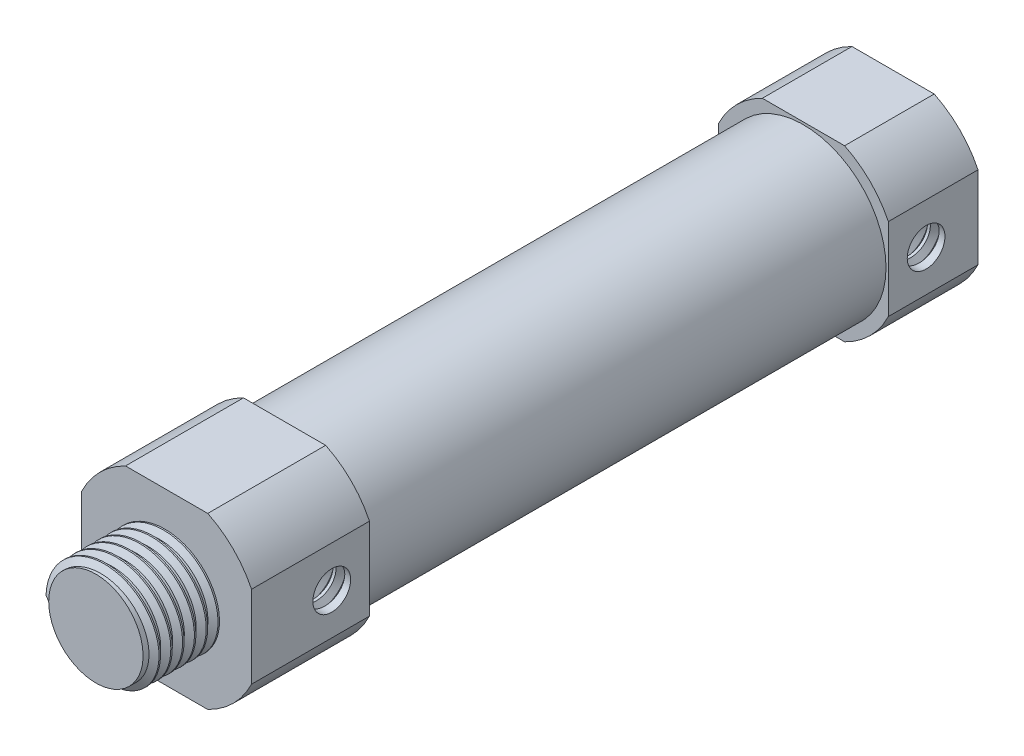
from build123d import *
from build123d.topology import SkipClean

# Parameters (mm, degrees)
SKETCH_1_R          = 10
EXTRUDE_1_DEPTH     = 9.5
SKETCH_2_R          = 15
SKETCH_2_W          = 18
SKETCH_2_H          = 18
CUT_EXTRUDE_1_DEPTH = 9.5
SKETCH_3_R          = 8.75
EXTRUDE_2_DEPTH     = 55
EXTRUDE_3_DEPTH     = 12.5
SKETCH_5_R          = 5
EXTRUDE_4_DEPTH     = 7.5
THREAD_1_PITCH      = 1.25
SKETCH_11_R         = 2
CUT_EXTRUDE_2_DEPTH = 5
THREAD_2_PITCH      = 1.25
THREAD_3_PITCH      = 1.25


with BuildPart() as part:
    # Sketch 1 → 凸台-拉伸1 (new body)
    with BuildSketch(Plane.XY):
        Circle(SKETCH_1_R)
    extrude(amount=EXTRUDE_1_DEPTH)

    # Sketch 2 → 切除-拉伸1 (cut)
    with BuildSketch(Plane.XY.offset(9.5)):
        Circle(SKETCH_2_R)
        Rectangle(SKETCH_2_W, SKETCH_2_H, mode=Mode.SUBTRACT)
    extrude(amount=-CUT_EXTRUDE_1_DEPTH, mode=Mode.SUBTRACT)

    # Sketch 3 → 凸台-拉伸2 (add)
    with BuildSketch(Plane.XY.offset(9.5)):
        Circle(SKETCH_3_R)
    extrude(amount=EXTRUDE_2_DEPTH)

    # 草图4 → 凸台-拉伸3 (add)
    with BuildSketch(Plane.XY.offset(64.5)):
        with BuildLine():
            Line((-4.358898944, -9), (4.358898944, -9))
            ThreePointArc((4.358898944, -9), (7.071067812, -7.071067812), (9, -4.358898944))
            Line((9, -4.358898944), (9, 4.358898944))
            ThreePointArc((9, 4.358898944), (7.071067812, 7.071067812), (4.358898944, 9))
            Line((4.358898944, 9), (-4.358898944, 9))
            ThreePointArc((-4.358898944, 9), (-7.071067812, 7.071067812), (-9, 4.358898944))
            Line((-9, 4.358898944), (-9, -4.358898944))
            ThreePointArc((-9, -4.358898944), (-7.071067812, -7.071067812), (-4.358898944, -9))
        make_face()
    extrude(amount=EXTRUDE_3_DEPTH)

    # 草图5 → 凸台-拉伸4 (add)
    with BuildSketch(Plane.XY.offset(77)):
        Circle(SKETCH_5_R)
    extrude(amount=EXTRUDE_4_DEPTH)

    # 螺纹线1: the profile of Sketch 1 2 profile screwed along a right-hand helix of 6 turns, 8 arcs to a turn; built about Z, then put on its axis
    thread_1_z = Axis((0, 0, 0), (0, 0, 1))
    thread_1_corners = [(4.9997, 0, -0.000173205), (5.676582344, 0, 0.390624998), (5.676582344, 0, 0.546874998), (4.9997, 0, 0.937673202)]
    with BuildLine(mode=Mode.PRIVATE) as thread_1_profile:
        Line(thread_1_corners[0], thread_1_corners[1])
        Line(thread_1_corners[1], thread_1_corners[2])
        Line(thread_1_corners[2], thread_1_corners[3])
        Line(thread_1_corners[3], thread_1_corners[0])
    thread_1_cap = Face(thread_1_profile.wire())
    thread_1_turn_angles = [0, 22.5, 45, 67.5, 90, 112.5, 135, 157.5, 180, 202.5, 225, 247.5, 270, 292.5, 315, 337.5, 360]
    thread_1_turn_weights = [1, 0.9238795325112867, 1, 0.9238795325112867, 1, 0.9238795325112867, 1, 0.9238795325112867, 1, 0.9238795325112867, 1, 0.9238795325112867, 1, 0.9238795325112867, 1, 0.9238795325112867, 1]
    thread_1_turn_rails = [Edge.make_bspline([Vector(p[0], p[1], 0).rotate(thread_1_z, thread_1_turn_angles[k]) / thread_1_turn_weights[k] + Vector(0, 0, p[2] + THREAD_1_PITCH * thread_1_turn_angles[k] / 360) for k in range(17)], [0, 0, 0, 1, 1, 2, 2, 3, 3, 4, 4, 5, 5, 6, 6, 7, 7, 8, 8, 8], 2, thread_1_turn_weights) for p in thread_1_corners]
    thread_1_turn_sides = [Face.make_surface_from_curves(thread_1_turn_rails[p[0]], thread_1_turn_rails[p[1]]) for p in [(0, 1), (1, 2), (2, 3), (3, 0)]]
    thread_1 = Plane(origin=(0, 0, 84.5), x_dir=(-1, 0, 0), z_dir=(0, 0, -1)) * Solid(Shell([*[p.moved(Location((0, 0, THREAD_1_PITCH * i))) for i in range(6) for p in thread_1_turn_sides], thread_1_cap, thread_1_cap.rotate(thread_1_z, 2160).moved(Location((0, 0, THREAD_1_PITCH * 2160 / 360)))]))
    add(thread_1)

    # 草图11 → 切除-拉伸2 (cut)
    with BuildSketch(Plane(origin=(9, 0, 0), x_dir=(0, 0, -1), z_dir=(1, 0, 0))):
        with Locations((-68.5, 0)):
            Circle(SKETCH_11_R)
        with Locations((-5.5, 0)):
            Circle(SKETCH_11_R)
    extrude(amount=-CUT_EXTRUDE_2_DEPTH, mode=Mode.SUBTRACT)

    # 螺纹线2: the profile of Sketch 2 2 profile screwed along a right-hand helix of 4 turns, 8 arcs to a turn; built about Z, then put on its axis
    with SkipClean():  # the faces are left unmerged after this step: merging them gives an invalid solid
        thread_2_z = Axis((0, 0, 0), (0, 0, 1))
        thread_2_corners = [(1.9997, 0, -0.000173205), (2.676582344, 0, 0.390624998), (2.676582344, 0, 0.546874998), (1.9997, 0, 0.937673202)]
        with BuildLine(mode=Mode.PRIVATE) as thread_2_profile:
            Line(thread_2_corners[0], thread_2_corners[1])
            Line(thread_2_corners[1], thread_2_corners[2])
            Line(thread_2_corners[2], thread_2_corners[3])
            Line(thread_2_corners[3], thread_2_corners[0])
        thread_2_cap = Face(thread_2_profile.wire())
        thread_2_turn_angles = [0, 22.5, 45, 67.5, 90, 112.5, 135, 157.5, 180, 202.5, 225, 247.5, 270, 292.5, 315, 337.5, 360]
        thread_2_turn_weights = [1, 0.9238795325112867, 1, 0.9238795325112867, 1, 0.9238795325112867, 1, 0.9238795325112867, 1, 0.9238795325112867, 1, 0.9238795325112867, 1, 0.9238795325112867, 1, 0.9238795325112867, 1]
        thread_2_turn_rails = [Edge.make_bspline([Vector(p[0], p[1], 0).rotate(thread_2_z, thread_2_turn_angles[k]) / thread_2_turn_weights[k] + Vector(0, 0, p[2] + THREAD_2_PITCH * thread_2_turn_angles[k] / 360) for k in range(17)], [0, 0, 0, 1, 1, 2, 2, 3, 3, 4, 4, 5, 5, 6, 6, 7, 7, 8, 8, 8], 2, thread_2_turn_weights) for p in thread_2_corners]
        thread_2_turn_sides = [Face.make_surface_from_curves(thread_2_turn_rails[p[0]], thread_2_turn_rails[p[1]]) for p in [(0, 1), (1, 2), (2, 3), (3, 0)]]
        thread_2 = Plane(origin=(9, 0, 68.5), x_dir=(0, 0, 1), z_dir=(-1, 0, 0)) * Solid(Shell([*[p.moved(Location((0, 0, THREAD_2_PITCH * i))) for i in range(4) for p in thread_2_turn_sides], thread_2_cap, thread_2_cap.rotate(thread_2_z, 1440).moved(Location((0, 0, THREAD_2_PITCH * 1440 / 360)))]))
        add(thread_2, mode=Mode.SUBTRACT)

    # 螺纹线3: the profile of Sketch 3 2 profile screwed along a right-hand helix of 4 turns, 8 arcs to a turn; built about Z, then put on its axis
    with SkipClean():  # the faces are left unmerged after this step: merging them gives an invalid solid
        thread_3_z = Axis((0, 0, 0), (0, 0, 1))
        thread_3_corners = [(1.9997, 0, -0.000173205), (2.676582344, 0, 0.390624998), (2.676582344, 0, 0.546874998), (1.9997, 0, 0.937673202)]
        with BuildLine(mode=Mode.PRIVATE) as thread_3_profile:
            Line(thread_3_corners[0], thread_3_corners[1])
            Line(thread_3_corners[1], thread_3_corners[2])
            Line(thread_3_corners[2], thread_3_corners[3])
            Line(thread_3_corners[3], thread_3_corners[0])
        thread_3_cap = Face(thread_3_profile.wire())
        thread_3_turn_angles = [0, 22.5, 45, 67.5, 90, 112.5, 135, 157.5, 180, 202.5, 225, 247.5, 270, 292.5, 315, 337.5, 360]
        thread_3_turn_weights = [1, 0.9238795325112867, 1, 0.9238795325112867, 1, 0.9238795325112867, 1, 0.9238795325112867, 1, 0.9238795325112867, 1, 0.9238795325112867, 1, 0.9238795325112867, 1, 0.9238795325112867, 1]
        thread_3_turn_rails = [Edge.make_bspline([Vector(p[0], p[1], 0).rotate(thread_3_z, thread_3_turn_angles[k]) / thread_3_turn_weights[k] + Vector(0, 0, p[2] + THREAD_3_PITCH * thread_3_turn_angles[k] / 360) for k in range(17)], [0, 0, 0, 1, 1, 2, 2, 3, 3, 4, 4, 5, 5, 6, 6, 7, 7, 8, 8, 8], 2, thread_3_turn_weights) for p in thread_3_corners]
        thread_3_turn_sides = [Face.make_surface_from_curves(thread_3_turn_rails[p[0]], thread_3_turn_rails[p[1]]) for p in [(0, 1), (1, 2), (2, 3), (3, 0)]]
        thread_3 = Plane(origin=(9, 0, 5.5), x_dir=(0, 0, 1), z_dir=(-1, 0, 0)) * Solid(Shell([*[p.moved(Location((0, 0, THREAD_3_PITCH * i))) for i in range(4) for p in thread_3_turn_sides], thread_3_cap, thread_3_cap.rotate(thread_3_z, 1440).moved(Location((0, 0, THREAD_3_PITCH * 1440 / 360)))]))
        add(thread_3, mode=Mode.SUBTRACT)


solid = part.part
